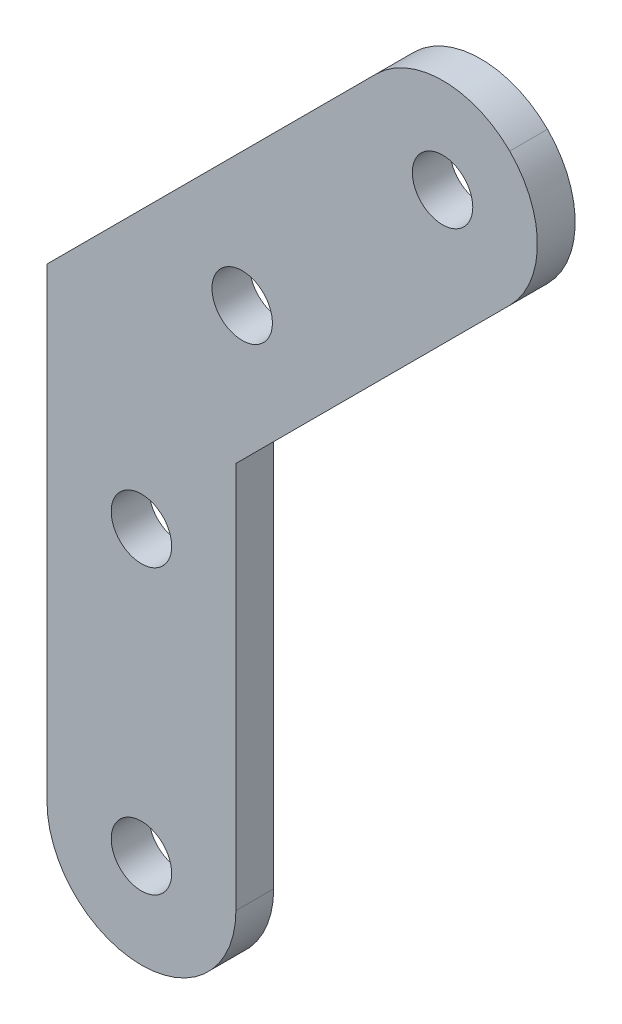
from build123d import *

# Parameters (mm, degrees)
EXTRUDE_1_DEPTH     = 1
FILLET_1_R          = 5
SKETCH_2_R          = 1.6
CUT_EXTRUDE_1_DEPTH = 37.340563377


with BuildPart() as part:
    # ｽｹｯﾁ1 → ﾎﾞｽ - 押し出し1 (new, symmetric)
    with BuildSketch(Plane.XY):
        Polygon((-3.827856705, 2.446999561), (-3.827856705, -19.777202359), (6.172143295, -19.777202359), (6.172143295, 5.722797641), (24.203366215, 23.754020561), (17.132298403, 30.825088373), (-3.827856705, 9.864933264), align=None)
    extrude(amount=EXTRUDE_1_DEPTH, both=True)

    # ﾌｨﾚｯﾄ1
    fillet_1_edges = [part.edges().sort_by_distance(p)[0] for p in [
        (17.132298403, 30.825088373, 0),
        (-3.827856705, -19.777202359, 0),
        (6.172143295, -19.777202359, 0),
        (24.203366215, 23.754020561, 0),
    ]]
    fillet(fillet_1_edges, radius=FILLET_1_R - 0.0001)  # a hair under: the kernel refuses the full size

    # ｽｹｯﾁ2 → ｶｯﾄ - 押し出し1 (cut, through all)
    with BuildSketch(Plane.XY.offset(1)):
        with Locations((1.172143295, 0.222797641)):
            Circle(SKETCH_2_R)
        with Locations((1.172143295, -14.777202359)):
            Circle(SKETCH_2_R)
        with Locations((6.505160691, 13.126882849)):
            Circle(SKETCH_2_R)
        with Locations((17.111762409, 23.733484566)):
            Circle(SKETCH_2_R)
    extrude(amount=-CUT_EXTRUDE_1_DEPTH, mode=Mode.SUBTRACT)


solid = part.part
